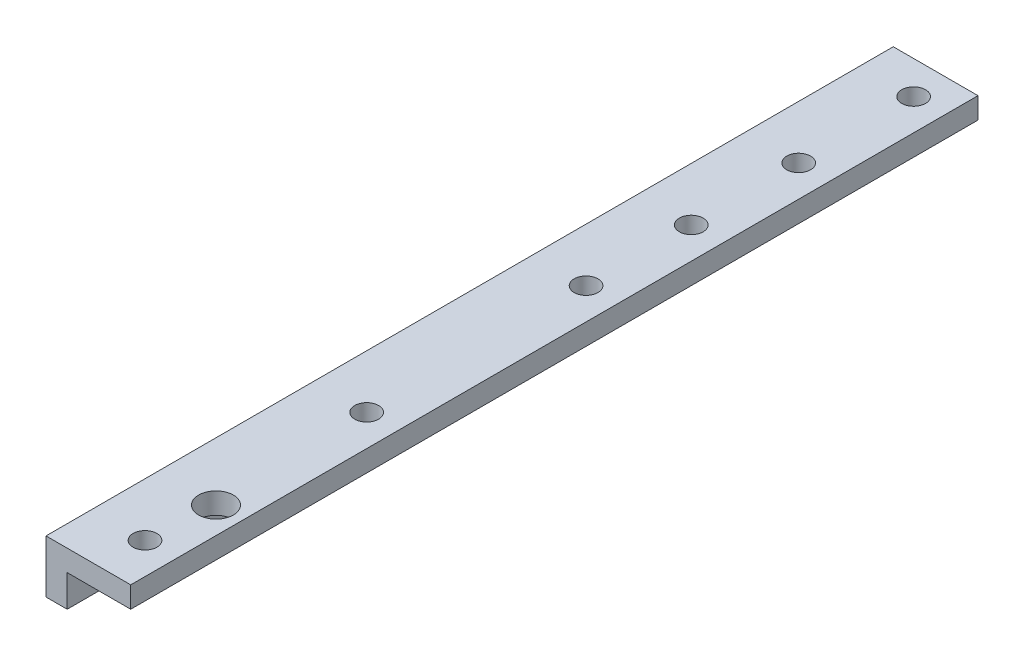
from build123d import *

# Parameters (mm, degrees)
BOSS_EXTRUDE1_DEPTH  = 160
M4_CLEARANCE_HOLE1_D = 4.5
SKETCH5_R            = 3.275
CUT_EXTRUDE2_DEPTH   = 10


with BuildPart() as part:
    # Sketch1 → Boss-Extrude1 (new body)
    with BuildSketch(Plane.XY):
        Polygon((0, 0), (0, -10), (4, -10), (4, -4), (16, -4), (16, 0), align=None)
    extrude(amount=BOSS_EXTRUDE1_DEPTH)

    # M4 Clearance Hole1 (through all)
    with Locations(Plane(origin=(0, -4, 0), x_dir=(-1, 0, 0), z_dir=(0, -1, 0))):
        with Locations((-10.072352995, -6.228090532), (-10.072352995, -27.937872474), (-10.072352995, -48.221464361), (-10.072352995, -68.087621842), (-10.072352995, -109.517546491), (-10.072352995, -151.376567413)):
            Hole(M4_CLEARANCE_HOLE1_D / 2)

    # Sketch5 → Cut-Extrude2 (cut)
    with BuildSketch(Plane.XZ.offset(4)):
        with Locations((11, 138.897931951)):
            Circle(SKETCH5_R)
    extrude(amount=-CUT_EXTRUDE2_DEPTH, mode=Mode.SUBTRACT)


solid = part.part
